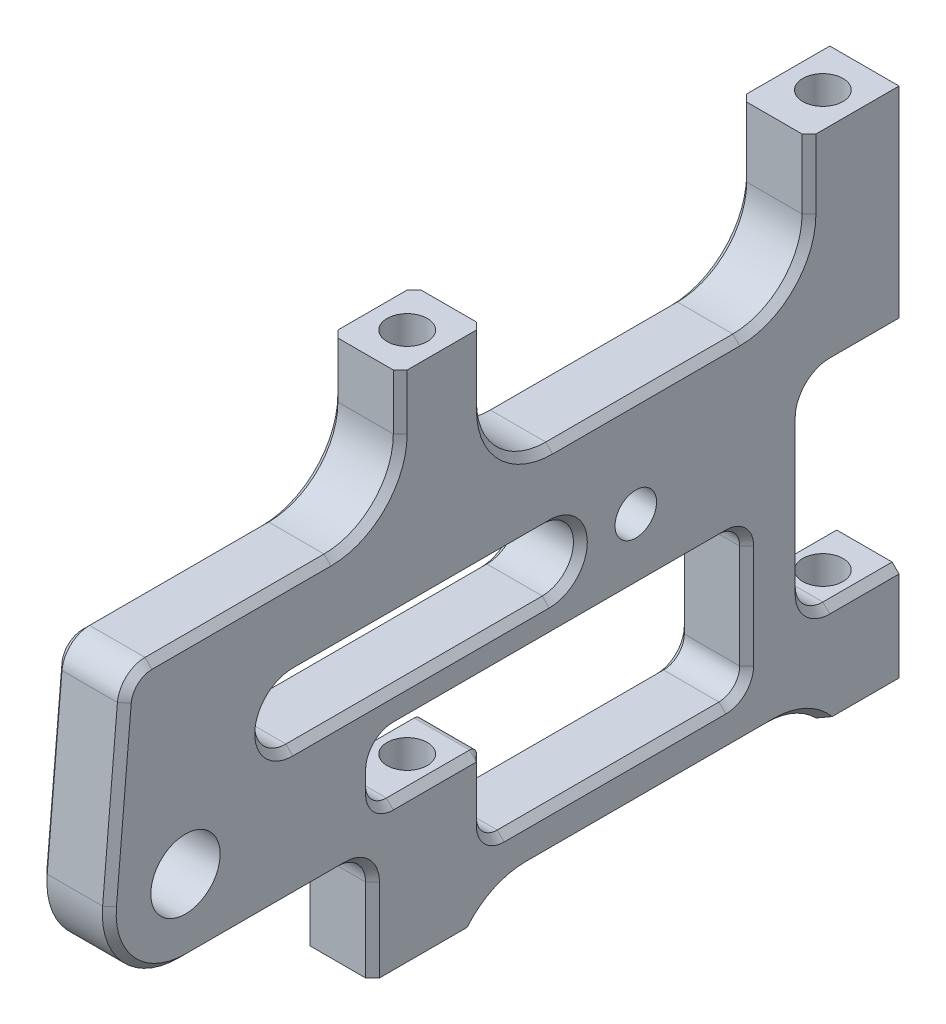
from build123d import *

# Parameters (mm, degrees)
ESQUISSE1_W             = 57
ESQUISSE1_H             = 37
BOSS_EXTRU_1_DEPTH      = 2.5
ESQUISSE2_W             = 7
ESQUISSE2_H             = 15
ENL_V_MAT_EXTRU_1_DEPTH = 69.139562664
ESQUISSE3_W             = 23.5
ESQUISSE3_H             = 10
ENL_V_MAT_EXTRU_2_DEPTH = 69.139562664
ESQUISSE4_W             = 21
ESQUISSE4_H             = 9
ENL_V_MAT_EXTRU_3_DEPTH = 69.139562664
ESQUISSE5_W             = 19
ESQUISSE5_H             = 8
ENL_V_MAT_EXTRU_4_DEPTH = 69.139562664
ESQUISSE6_R             = 2.5
ENL_V_MAT_EXTRU_5_DEPTH = 5
ENL_V_MAT_EXTRU_6_DEPTH = 69.139562664
ESQUISSE8_R             = 1.5
ENL_V_MAT_EXTRU_7_DEPTH = 69.139562664
ESQUISSE9_W             = 25
ESQUISSE9_H             = 1.5
ENL_V_MAT_EXTRU_8_DEPTH = 69.139562664
CONG_1_R                = 5
CONG_2_R                = 1.5
CONG_3_R                = 0.5
CONG_4_R                = 2
CONG_5_R                = 2
TROU_TARAUD_M3_51_D     = 2.9
TROU_TARAUD_M3_51_DEPTH = 12
TROU_TARAUD_M3_51_TIP   = 0.871247898
TROU_TARAUD_M3_52_D     = 2.9
TROU_TARAUD_M3_52_DEPTH = 10
TROU_TARAUD_M3_52_TIP   = 0.871247898
CHANFREIN1_SIZE         = 0.5


with BuildPart() as part:
    # Esquisse1 → Boss.-Extru.1 (new, symmetric)
    with BuildSketch(Plane(origin=(0, 0, 0), x_dir=(0, 0, -1), z_dir=(1, 0, 0))):
        with Locations((-28.5, 18.5)):
            Rectangle(ESQUISSE1_W, ESQUISSE1_H)
    extrude(amount=BOSS_EXTRU_1_DEPTH, both=True)

    # Esquisse2 → Enlèv. mat.-Extru.1 (cut, through all)
    with BuildSketch(Plane(origin=(2.5, 0, 0), x_dir=(0, 0, -1), z_dir=(1, 0, 0))):
        with Locations((-3.5, 14.5)):
            Rectangle(ESQUISSE2_W, ESQUISSE2_H)
    extrude(amount=-ENL_V_MAT_EXTRU_1_DEPTH, mode=Mode.SUBTRACT)

    # Esquisse3 → Enlèv. mat.-Extru.2 (cut, through all)
    with BuildSketch(Plane(origin=(2.5, 0, 0), x_dir=(0, 0, -1), z_dir=(1, 0, 0))):
        with Locations((-18.25, 32)):
            Rectangle(ESQUISSE3_W, ESQUISSE3_H)
    extrude(amount=-ENL_V_MAT_EXTRU_2_DEPTH, mode=Mode.SUBTRACT)

    # Esquisse4 → Enlèv. mat.-Extru.3 (cut, through all)
    with BuildSketch(Plane(origin=(2.5, 0, 0), x_dir=(0, 0, -1), z_dir=(1, 0, 0))):
        with Locations((-46.5, 32.5)):
            Rectangle(ESQUISSE4_W, ESQUISSE4_H)
    extrude(amount=-ENL_V_MAT_EXTRU_3_DEPTH, mode=Mode.SUBTRACT)

    # Esquisse5 → Enlèv. mat.-Extru.4 (cut, through all)
    with BuildSketch(Plane(origin=(2.5, 0, 0), x_dir=(0, 0, -1), z_dir=(1, 0, 0))):
        with Locations((-47.5, 4)):
            Rectangle(ESQUISSE5_W, ESQUISSE5_H)
    extrude(amount=-ENL_V_MAT_EXTRU_4_DEPTH, mode=Mode.SUBTRACT)

    # Esquisse6 → Enlèv. mat.-Extru.5 (cut)
    with BuildSketch(Plane(origin=(2.5, 0, 0), x_dir=(0, 0, -1), z_dir=(1, 0, 0))):
        with BuildLine():
            Line((-57, 28), (-57, 13.5))
            ThreePointArc((-57, 13.5), (-56.994765219, 13.739906631), (-56.97907084, 13.979356585))
            Line((-56.97907084, 13.979356585), (-55.752423485, 28))
            Line((-55.752423485, 28), (-57, 28))
        make_face()
        with BuildLine():
            Line((-57, 8), (-51.5, 8))
            ThreePointArc((-51.5, 8), (-55.389087297, 9.610912703), (-57, 13.5))
            Line((-57, 13.5), (-57, 8))
        make_face()
        with Locations((-51.5, 13.5)):
            Circle(ESQUISSE6_R)
    extrude(amount=-ENL_V_MAT_EXTRU_5_DEPTH, mode=Mode.SUBTRACT)

    # Esquisse7 → Enlèv. mat.-Extru.6 (cut, through all)
    with BuildSketch(Plane(origin=(2.5, 0, 0), x_dir=(0, 0, -1), z_dir=(1, 0, 0))):
        Polygon((-38, 15), (-11, 15), (-11, 4.5), (-30, 4.5), (-30, 10.5), (-38, 10.5), align=None)
    extrude(amount=-ENL_V_MAT_EXTRU_6_DEPTH, mode=Mode.SUBTRACT)

    # Esquisse8 → Enlèv. mat.-Extru.7 (cut, through all)
    with BuildSketch(Plane(origin=(2.5, 0, 0), x_dir=(0, 0, -1), z_dir=(1, 0, 0))):
        with Locations((-19, 19.75)):
            Circle(ESQUISSE8_R)
        with BuildLine():
            Line((-43.75, 22), (-25.25, 22))
            ThreePointArc((-25.25, 22), (-23, 19.75), (-25.25, 17.5))
            Line((-25.25, 17.5), (-43.75, 17.5))
            ThreePointArc((-43.75, 17.5), (-46, 19.75), (-43.75, 22))
        make_face()
    extrude(amount=-ENL_V_MAT_EXTRU_7_DEPTH, mode=Mode.SUBTRACT)

    # Esquisse9 → Enlèv. mat.-Extru.8 (cut, through all)
    with BuildSketch(Plane(origin=(2.5, 0, 0), x_dir=(0, 0, -1), z_dir=(1, 0, 0))):
        with Locations((-18, 0.75)):
            Rectangle(ESQUISSE9_W, ESQUISSE9_H)
    extrude(amount=-ENL_V_MAT_EXTRU_8_DEPTH, mode=Mode.SUBTRACT)

    # Congé1
    # the kernel refuses this fillet: 5 mm, written as the material it adds along each edge
    with BuildSketch(Plane(origin=(2.5, 27, 30), x_dir=(0, 0, -1), z_dir=(-1, 0, 0)), Plane(origin=(2.5, 28, 36), x_dir=(0, 1, 0), z_dir=(-1, 0, 0)), Plane(origin=(2.5, 27, 6.5), x_dir=(0, 1, 0), z_dir=(-1, 0, 0))) as cong_1_piece_1:
        with BuildLine():
            CenterArc((CONG_1_R, -CONG_1_R), CONG_1_R, 90, 90)
            Line((0, -CONG_1_R), (-CONG_1_R * 0.02, -CONG_1_R))
            Line((-CONG_1_R * 0.02, -CONG_1_R), (-CONG_1_R * 0.02, CONG_1_R * 0.02))
            Line((-CONG_1_R * 0.02, CONG_1_R * 0.02), (CONG_1_R, CONG_1_R * 0.02))
            Line((CONG_1_R, CONG_1_R * 0.02), (CONG_1_R, 0))
        make_face()
    extrude(amount=5)
    with BuildSketch(Plane(origin=(2.5, 1.5, 5.5), x_dir=(0, -1, 0), z_dir=(-1, 0, 0))) as cong_1_piece_2:
        with BuildLine():
            CenterArc((5, 3.570714214), CONG_1_R, 180, 45.572995999)
            Line((0, 3.570714214), (-0.1, 3.570714214))
            Line((-0.1, 3.570714214), (-0.1, 0))
            Line((-0.1, 0), (0, -0.1))
            ThreePointArc((0, -0.1), (0.75, -0.1), (1.43, -0.071414284))
            Line((1.43, -0.071414284), (1.5, 0))
        make_face()
    extrude(amount=5)
    with BuildSketch(Plane(origin=(2.5, 1.5, 30.5), x_dir=(0, -1, 0), z_dir=(-1, 0, 0))) as cong_1_piece_3:
        with BuildLine():
            CenterArc((5, -3.570714214), CONG_1_R, 134.427004001, 45.572995999)
            Line((0, -3.570714214), (-0.1, -3.570714214))
            Line((-0.1, -3.570714214), (-0.1, 0))
            Line((-0.1, 0), (0, 0.1))
            ThreePointArc((0, 0.1), (0.75, 0.1), (1.43, 0.071414284))
            Line((1.43, 0.071414284), (1.5, 0))
        make_face()
    extrude(amount=5)

    # Congé2
    cong_2_edges = [part.edges().sort_by_distance(p)[0] for p in [
        (0, 10.5, 38),
        (0, 15, 38),
        (0, 15, 11),
        (0, 4.5, 11),
        (0, 4.5, 30),
    ]]
    fillet(cong_2_edges, radius=CONG_2_R)

    # Congé3
    cong_3_edges = [part.edges().sort_by_distance(p)[0] for p in [
        (0, 10.5, 30),
    ]]
    fillet(cong_3_edges, radius=CONG_3_R)

    # Congé4
    cong_4_edges = [part.edges().sort_by_distance(p)[0] for p in [
        (0, 7, 7),
        (0, 22, 7),
        (0, 8, 38),
    ]]
    fillet(cong_4_edges, radius=CONG_4_R)

    # Congé5
    cong_5_edges = [part.edges().sort_by_distance(p)[0] for p in [
        (0, 28, 55.752423485),
    ]]
    fillet(cong_5_edges, radius=CONG_5_R)

    # Trou taraudé M3.51
    with Locations(Plane(origin=(0, 0, 0), x_dir=(-1, 0, 0), z_dir=(0, -1, 0))):
        with Locations((0, -3), (0, -33)):
            Hole(TROU_TARAUD_M3_51_D / 2, depth=TROU_TARAUD_M3_51_DEPTH)
            with Locations((0, 0, -(TROU_TARAUD_M3_51_DEPTH + TROU_TARAUD_M3_51_TIP / 2))):  # 118° drill point
                Cone(0, TROU_TARAUD_M3_51_D / 2, TROU_TARAUD_M3_51_TIP, mode=Mode.SUBTRACT)

    # Trou taraudé M3.52
    with Locations(Plane(origin=(0, 37, 0), x_dir=(1, 0, 0), z_dir=(0, 1, 0))):
        with Locations((0, -33), (0, -3)):
            Hole(TROU_TARAUD_M3_52_D / 2, depth=TROU_TARAUD_M3_52_DEPTH)
            with Locations((0, 0, -(TROU_TARAUD_M3_52_DEPTH + TROU_TARAUD_M3_52_TIP / 2))):  # 118° drill point
                Cone(0, TROU_TARAUD_M3_52_D / 2, TROU_TARAUD_M3_52_TIP, mode=Mode.SUBTRACT)

    # Chanfrein1
    chanfrein1_edges = [part.edges().sort_by_distance(p)[0] for p in [
        (-2.5, 19.75, 46),
        (-2.5, 22, 34.5),
        (-2.5, 19.75, 23),
        (-2.5, 17.5, 34.5),
        (2.5, 19.75, 46),
        (2.5, 17.5, 34.5),
        (2.5, 19.75, 23),
        (2.5, 22, 34.5),
        (2.5, 1.5, 18),
        (-2.5, 1.5, 18),
        (2.5, 35, 36),
        (-2.5, 35, 36),
        (2.5, 34.5, 6.5),
        (-2.5, 34.5, 6.5),
        (2.5, 27, 18.25),
        (-2.5, 27, 18.25),
        (2.5, 1.109772229, 7.134222541),
        (-2.5, 1.109772229, 7.134222541),
        (2.5, 1.109772229, 28.865777459),
        (-2.5, 1.109772229, 28.865777459),
        (2.5, 29.464466094, 37.464466094),
        (-2.5, 29.464466094, 37.464466094),
        (2.5, 28.464466094, 7.964466094),
        (-2.5, 28.464466094, 7.964466094),
        (2.5, 28.464466094, 28.535533906),
        (-2.5, 28.464466094, 28.535533906),
        (2.5, 15, 24.5),
        (-2.5, 15, 24.5),
        (-2.5, 22, 2.5),
        (2.5, 9.75, 11),
        (-2.5, 9.75, 11),
        (2.5, 4.5, 20.5),
        (-2.5, 4.5, 20.5),
        (2.5, 10.5, 33.5),
        (2.5, 22, 2.5),
        (-2.5, 10.5, 33.5),
        (2.5, 12.75, 38),
        (-2.5, 12.75, 38),
        (2.5, 14.560660172, 11.439339828),
        (-2.5, 14.560660172, 11.439339828),
        (2.5, 4.939339828, 11.439339828),
        (-2.5, 4.939339828, 11.439339828),
        (2.5, 4.939339828, 29.560660172),
        (-2.5, 4.939339828, 29.560660172),
        (2.5, 10.939339828, 37.560660172),
        (-2.5, 10.939339828, 37.560660172),
        (2.5, 14.560660172, 37.560660172),
        (-2.5, 14.560660172, 37.560660172),
        (2.5, 8, 30),
        (-2.5, 8, 30),
        (2.5, 10.353553391, 30.146446609),
        (-2.5, 10.353553391, 30.146446609),
        (2.5, 7, 2.5),
        (-2.5, 7, 2.5),
        (2.5, 14.5, 7),
        (-2.5, 14.5, 7),
        (-2.5, 8, 45.75),
        (2.5, 8, 45.75),
        (2.5, 7.585786438, 6.414213562),
        (-2.5, 7.585786438, 6.414213562),
        (2.5, 21.414213562, 6.414213562),
        (-2.5, 21.414213562, 6.414213562),
        (2.5, 7.414213562, 38.585786438),
        (-2.5, 7.414213562, 38.585786438),
        (2.5, 28, 47.459880569),
        (-2.5, 28, 47.459880569),
        (2.5, 20.076834035, 56.445610687),
        (2.5, 27.474554674, 55.270941553),
        (-2.5, 20.076834035, 56.445610687),
        (-2.5, 27.474554674, 55.270941553),
        (-2.5, 34.5, 30),
        (2.5, 34.5, 30),
        (-2.5, 3, 38),
        (2.5, 3, 38),
        (2.5, 9.784253858, 55.555025352),
        (-2.5, 9.784253858, 55.555025352),
    ]]
    chamfer(chanfrein1_edges, length=CHANFREIN1_SIZE)


solid = part.part
